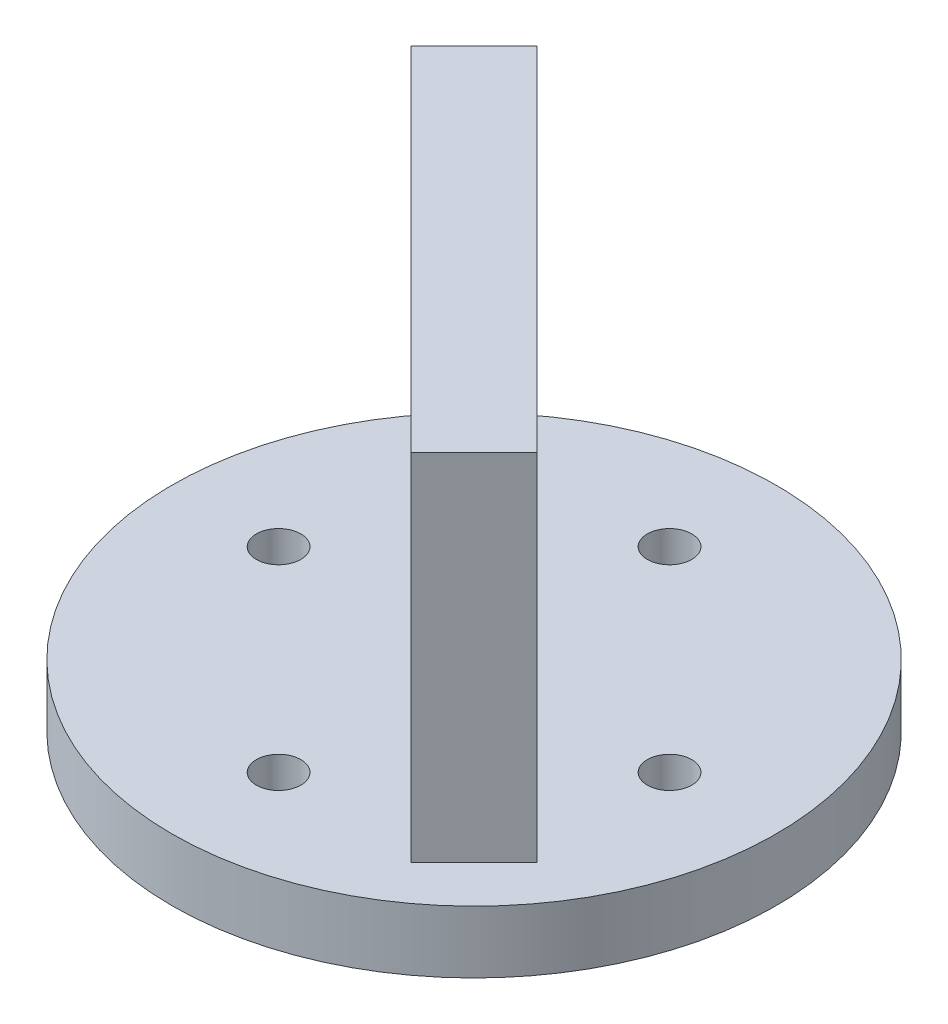
from build123d import *

# Parameters (mm, degrees)
SKETCH_1_R          = 34
EXTRUDE_1_DEPTH     = 7
SKETCH_2_R          = 2.5
CUT_EXTRUDE_1_DEPTH = 7
EXTRUDE_2_DEPTH     = 40


with BuildPart() as part:
    # 草图1 → 凸台-拉伸1 (new body)
    with BuildSketch(Plane(origin=(0, 0, 0), x_dir=(1, 0, 0), z_dir=(0, 1, 0))):
        Circle(SKETCH_1_R)
    extrude(amount=EXTRUDE_1_DEPTH)

    # 草图2 → 切除-拉伸1 (cut)
    with BuildSketch(Plane(origin=(0, 7, 0), x_dir=(1, 0, 0), z_dir=(0, 1, 0))):
        with Locations((22, 0)):
            Circle(SKETCH_2_R)
        with Locations((0, -22)):
            Circle(SKETCH_2_R)
        with Locations((-22, 0)):
            Circle(SKETCH_2_R)
        with Locations((0, 22)):
            Circle(SKETCH_2_R)
    extrude(amount=-CUT_EXTRUDE_1_DEPTH, mode=Mode.SUBTRACT)

    # 草图3 → 凸台-拉伸2 (add)
    with BuildSketch(Plane(origin=(0, 7, 0), x_dir=(1, 0, 0), z_dir=(0, 1, 0))):
        Polygon((-16.263455967, 23.334523779), (-23.334523779, 16.263455967), (16.263455967, -23.334523779), (23.334523779, -16.263455967), align=None)
    extrude(amount=EXTRUDE_2_DEPTH)


solid = part.part
